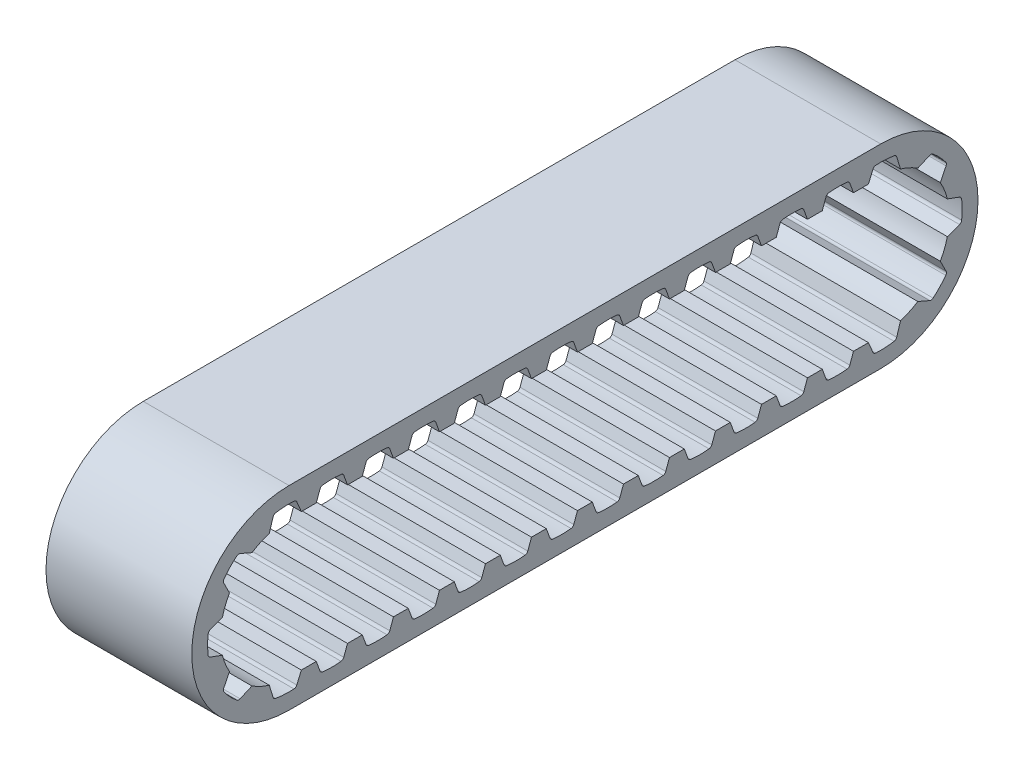
from build123d import *

# Parameters (mm, degrees)
SKETCH_2_W            = 5.8
SKETCH_2_H            = 1.14
CUT_EXTRUDE_1_DEPTH   = 28.834467159
PATTERN_START         = -2.9
PATTERN_CURVE_1_DEPTH = 5.8


# Read off the part's stored shape, not the designer's step: 曲线阵列1
with BuildPart() as part:
    # 扫描1: sweep along a path in 草图1
    with BuildLine(Plane(origin=(0, 0, 0), x_dir=(0, 0, -1), z_dir=(1, 0, 0))) as sweep_1_path:
        Line((0, 3.871), (23.54, 3.871))
        ThreePointArc((23.54, 3.871), (27.411, 0), (23.54, -3.871))
        Line((23.54, -3.871), (0, -3.871))
        ThreePointArc((0, -3.871), (-3.871, 0), (0, 3.871))
    # 草图2 → 扫描1 (sweep)
    with BuildSketch(Plane.XY):
        with Locations((0, 3.301)):
            Rectangle(SKETCH_2_W, SKETCH_2_H)
    sweep(path=sweep_1_path.line)

    # 草图3 → 切除-拉伸1 (cut, symmetric)
    with BuildSketch(Plane(origin=(0, 0, 0), x_dir=(0, 0, -1), z_dir=(1, 0, 0))):
        with BuildLine():
            Line((-3.135600662, 0.473139521), (-1.457, 1.084100197))
            Line((-1.457, 1.084100197), (-1.457, -1.084100197))
            Line((-1.457, -1.084100197), (-3.135600662, -0.473139521))
            ThreePointArc((-3.135600662, -0.473139521), (-3.193244809, -0.431441946), (-3.220308068, -0.365645932))
            ThreePointArc((-3.220308068, -0.365645932), (-3.241, 0), (-3.220308068, 0.365645932))
            ThreePointArc((-3.220308068, 0.365645932), (-3.193244809, 0.431441946), (-3.135600662, 0.473139521))
        make_face()
    extrude(amount=CUT_EXTRUDE_1_DEPTH, both=True, mode=Mode.SUBTRACT)

    # 曲线阵列1 outline → 曲线阵列1 (cut)
    with BuildSketch(Plane.YZ.offset(PATTERN_START)):
        with BuildLine():
            ThreePointArc((2.501432533, 1.949022269), (2.510859431, 2.019539423), (2.481755951, 2.084458779))
            ThreePointArc((2.481755951, 2.084458779), (2.23074509, 2.351139584), (1.951250165, 2.587799025))
            ThreePointArc((1.951250165, 2.587799025), (1.88489199, 2.613453032), (1.814967209, 2.600335853))
            Line((1.814967209, 2.600335853), (1.355181001, 2.371043115))
            ThreePointArc((1.355181001, 2.371043115), (1.879717631, 1.981166986), (2.296602394, 1.477828963))
            Line((2.296602394, 1.477828963), (2.501432533, 1.949022269))
        make_face()
        with BuildLine():
            Line((-2.501432533, 1.949022269), (-2.296602394, 1.477828963))
            ThreePointArc((-2.296602394, 1.477828963), (-1.879717631, 1.981166986), (-1.355181001, 2.371043115))
            Line((-1.355181001, 2.371043115), (-1.814967209, 2.600335853))
            ThreePointArc((-1.814967209, 2.600335853), (-1.88489199, 2.613453032), (-1.951250165, 2.587799025))
            ThreePointArc((-1.951250165, 2.587799025), (-2.23074509, 2.351139584), (-2.481755951, 2.084458779))
            ThreePointArc((-2.481755951, 2.084458779), (-2.510859431, 2.019539423), (-2.501432533, 1.949022269))
        make_face()
        with BuildLine():
            Line((-3.156121228, -0.307817011), (-2.731, -0.488360795))
            Line((-2.731, -0.488360795), (-2.731, 0))
            ThreePointArc((-2.731, 0), (-2.701859768, 0.397887919), (-2.615060933, 0.787284776))
            Line((-2.615060933, 0.787284776), (-3.106426315, 0.637156238))
            ThreePointArc((-3.106426315, 0.637156238), (-3.166180712, 0.59854345), (-3.196661978, 0.534259487))
            ThreePointArc((-3.196661978, 0.534259487), (-3.236527666, 0.170204779), (-3.235066597, -0.19602325))
            ThreePointArc((-3.235066597, -0.19602325), (-3.211496035, -0.263149728), (-3.156121228, -0.307817011))
        make_face()
        with BuildLine():
            Line((-3.135600662, -2.176722499), (-2.731, -2.323985096))
            Line((-2.731, -2.323985096), (-2.731, -1.083180859))
            Line((-2.731, -1.083180859), (-3.135600662, -1.230443456))
            ThreePointArc((-3.135600662, -1.230443456), (-3.193244809, -1.272141031), (-3.220308068, -1.337937045))
            ThreePointArc((-3.220308068, -1.337937045), (-3.241, -1.703582978), (-3.220308068, -2.06922891))
            ThreePointArc((-3.220308068, -2.06922891), (-3.193244809, -2.135024924), (-3.135600662, -2.176722499))
        make_face()
        with BuildLine():
            Line((-3.135600662, -4.006980139), (-2.731, -4.154242737))
            Line((-2.731, -4.154242737), (-2.731, -2.913438499))
            Line((-2.731, -2.913438499), (-3.135600662, -3.060701097))
            ThreePointArc((-3.135600662, -3.060701097), (-3.193244809, -3.102398672), (-3.220308068, -3.168194685))
            ThreePointArc((-3.220308068, -3.168194685), (-3.241, -3.533840618), (-3.220308068, -3.89948655))
            ThreePointArc((-3.220308068, -3.89948655), (-3.193244809, -3.965282564), (-3.135600662, -4.006980139))
        make_face()
        with BuildLine():
            Line((-3.135600662, -5.837237779), (-2.731, -5.984500377))
            Line((-2.731, -5.984500377), (-2.731, -4.743696139))
            Line((-2.731, -4.743696139), (-3.135600662, -4.890958737))
            ThreePointArc((-3.135600662, -4.890958737), (-3.193244809, -4.932656312), (-3.220308068, -4.998452326))
            ThreePointArc((-3.220308068, -4.998452326), (-3.241, -5.364098259), (-3.220308068, -5.729744191))
            ThreePointArc((-3.220308068, -5.729744191), (-3.193244809, -5.795540205), (-3.135600662, -5.837237779))
        make_face()
        with BuildLine():
            Line((-3.135600662, -7.66749542), (-2.731, -7.814758018))
            Line((-2.731, -7.814758018), (-2.731, -6.57395378))
            Line((-2.731, -6.57395378), (-3.135600662, -6.721216378))
            ThreePointArc((-3.135600662, -6.721216378), (-3.193244809, -6.762913953), (-3.220308068, -6.828709966))
            ThreePointArc((-3.220308068, -6.828709966), (-3.241, -7.194355898), (-3.220308068, -7.560001831))
            ThreePointArc((-3.220308068, -7.560001831), (-3.193244809, -7.625797845), (-3.135600662, -7.66749542))
        make_face()
        with BuildLine():
            Line((-3.135600662, -9.49775306), (-2.731, -9.645015658))
            Line((-2.731, -9.645015658), (-2.731, -8.40421142))
            Line((-2.731, -8.40421142), (-3.135600662, -8.551474018))
            ThreePointArc((-3.135600662, -8.551474018), (-3.193244809, -8.593171593), (-3.220308068, -8.658967607))
            ThreePointArc((-3.220308068, -8.658967607), (-3.241, -9.02461354), (-3.220308068, -9.390259472))
            ThreePointArc((-3.220308068, -9.390259472), (-3.193244809, -9.456055486), (-3.135600662, -9.49775306))
        make_face()
        with BuildLine():
            Line((-3.135600662, -11.328010701), (-2.731, -11.475273299))
            Line((-2.731, -11.475273299), (-2.731, -10.234469061))
            Line((-2.731, -10.234469061), (-3.135600662, -10.381731659))
            ThreePointArc((-3.135600662, -10.381731659), (-3.193244809, -10.423429233), (-3.220308068, -10.489225247))
            ThreePointArc((-3.220308068, -10.489225247), (-3.241, -10.854871179), (-3.220308068, -11.220517112))
            ThreePointArc((-3.220308068, -11.220517112), (-3.193244809, -11.286313126), (-3.135600662, -11.328010701))
        make_face()
        with BuildLine():
            Line((-3.135600662, -13.158268341), (-2.731, -13.305530939))
            Line((-2.731, -13.305530939), (-2.731, -12.064726701))
            Line((-2.731, -12.064726701), (-3.135600662, -12.211989299))
            ThreePointArc((-3.135600662, -12.211989299), (-3.193244809, -12.253686874), (-3.220308068, -12.319482888))
            ThreePointArc((-3.220308068, -12.319482888), (-3.241, -12.685128821), (-3.220308068, -13.050774753))
            ThreePointArc((-3.220308068, -13.050774753), (-3.193244809, -13.116570767), (-3.135600662, -13.158268341))
        make_face()
        with BuildLine():
            Line((-3.135600662, -14.988525982), (-2.731, -15.13578858))
            Line((-2.731, -15.13578858), (-2.731, -13.894984342))
            Line((-2.731, -13.894984342), (-3.135600662, -14.04224694))
            ThreePointArc((-3.135600662, -14.04224694), (-3.193244809, -14.083944514), (-3.220308068, -14.149740528))
            ThreePointArc((-3.220308068, -14.149740528), (-3.241, -14.515386461), (-3.220308068, -14.881032393))
            ThreePointArc((-3.220308068, -14.881032393), (-3.193244809, -14.946828407), (-3.135600662, -14.988525982))
        make_face()
        with BuildLine():
            Line((-3.135600662, -16.818783622), (-2.731, -16.96604622))
            Line((-2.731, -16.96604622), (-2.731, -15.725241982))
            Line((-2.731, -15.725241982), (-3.135600662, -15.87250458))
            ThreePointArc((-3.135600662, -15.87250458), (-3.193244809, -15.914202155), (-3.220308068, -15.979998169))
            ThreePointArc((-3.220308068, -15.979998169), (-3.241, -16.345644101), (-3.220308068, -16.711290034))
            ThreePointArc((-3.220308068, -16.711290034), (-3.193244809, -16.777086047), (-3.135600662, -16.818783622))
        make_face()
        with BuildLine():
            Line((-3.135600662, -18.649041263), (-2.731, -18.796303861))
            Line((-2.731, -18.796303861), (-2.731, -17.555499623))
            Line((-2.731, -17.555499623), (-3.135600662, -17.702762221))
            ThreePointArc((-3.135600662, -17.702762221), (-3.193244809, -17.744459795), (-3.220308068, -17.810255809))
            ThreePointArc((-3.220308068, -17.810255809), (-3.241, -18.175901741), (-3.220308068, -18.541547674))
            ThreePointArc((-3.220308068, -18.541547674), (-3.193244809, -18.607343688), (-3.135600662, -18.649041263))
        make_face()
        with BuildLine():
            Line((-3.135600662, -20.479298903), (-2.731, -20.626561501))
            Line((-2.731, -20.626561501), (-2.731, -19.385757263))
            Line((-2.731, -19.385757263), (-3.135600662, -19.533019861))
            ThreePointArc((-3.135600662, -19.533019861), (-3.193244809, -19.574717436), (-3.220308068, -19.64051345))
            ThreePointArc((-3.220308068, -19.64051345), (-3.241, -20.006159382), (-3.220308068, -20.371805315))
            ThreePointArc((-3.220308068, -20.371805315), (-3.193244809, -20.437601328), (-3.135600662, -20.479298903))
        make_face()
        with BuildLine():
            Line((-3.135600662, -22.309556544), (-2.731, -22.456819141))
            Line((-2.731, -22.456819141), (-2.731, -21.216014904))
            Line((-2.731, -21.216014904), (-3.135600662, -21.363277501))
            ThreePointArc((-3.135600662, -21.363277501), (-3.193244809, -21.404975076), (-3.220308068, -21.47077109))
            ThreePointArc((-3.220308068, -21.47077109), (-3.241, -21.836417023), (-3.220308068, -22.202062955))
            ThreePointArc((-3.220308068, -22.202062955), (-3.193244809, -22.267858969), (-3.135600662, -22.309556544))
        make_face()
        with BuildLine():
            Line((-3.106426315, -24.177156238), (-2.615060933, -24.327284776))
            ThreePointArc((-2.615060933, -24.327284776), (-2.701859768, -23.937887919), (-2.731, -23.54))
            Line((-2.731, -23.54), (-2.731, -23.051639205))
            Line((-2.731, -23.051639205), (-3.156121228, -23.232182989))
            ThreePointArc((-3.156121228, -23.232182989), (-3.211496035, -23.276850272), (-3.235066597, -23.34397675))
            ThreePointArc((-3.235066597, -23.34397675), (-3.236527666, -23.710204779), (-3.196661978, -24.074259487))
            ThreePointArc((-3.196661978, -24.074259487), (-3.166180712, -24.13854345), (-3.106426315, -24.177156238))
        make_face()
        with BuildLine():
            Line((-1.814967209, -26.140335853), (-1.355181001, -25.911043115))
            ThreePointArc((-1.355181001, -25.911043115), (-1.879717631, -25.521166986), (-2.296602394, -25.017828963))
            Line((-2.296602394, -25.017828963), (-2.501432533, -25.489022269))
            ThreePointArc((-2.501432533, -25.489022269), (-2.510859431, -25.559539423), (-2.481755951, -25.624458779))
            ThreePointArc((-2.481755951, -25.624458779), (-2.23074509, -25.891139584), (-1.951250165, -26.127799025))
            ThreePointArc((-1.951250165, -26.127799025), (-1.88489199, -26.153453032), (-1.814967209, -26.140335853))
        make_face()
        with BuildLine():
            Line((0.473139521, -26.675600662), (0.648865502, -26.192797497))
            ThreePointArc((0.648865502, -26.192797497), (0, -26.271), (-0.648865502, -26.192797497))
            Line((-0.648865502, -26.192797497), (-0.473139521, -26.675600662))
            ThreePointArc((-0.473139521, -26.675600662), (-0.431441946, -26.733244809), (-0.365645932, -26.760308068))
            ThreePointArc((-0.365645932, -26.760308068), (0, -26.781), (0.365645932, -26.760308068))
            ThreePointArc((0.365645932, -26.760308068), (0.431441946, -26.733244809), (0.473139521, -26.675600662))
        make_face()
        with BuildLine():
            Line((2.501432533, -25.489022269), (2.296602394, -25.017828963))
            ThreePointArc((2.296602394, -25.017828963), (1.879717631, -25.521166986), (1.355181001, -25.911043115))
            Line((1.355181001, -25.911043115), (1.814967209, -26.140335853))
            ThreePointArc((1.814967209, -26.140335853), (1.88489199, -26.153453032), (1.951250165, -26.127799025))
            ThreePointArc((1.951250165, -26.127799025), (2.23074509, -25.891139584), (2.481755951, -25.624458779))
            ThreePointArc((2.481755951, -25.624458779), (2.510859431, -25.559539423), (2.501432533, -25.489022269))
        make_face()
        with BuildLine():
            Line((3.156121228, -23.232182989), (2.731, -23.051639205))
            Line((2.731, -23.051639205), (2.731, -23.54))
            ThreePointArc((2.731, -23.54), (2.701859768, -23.937887919), (2.615060933, -24.327284776))
            Line((2.615060933, -24.327284776), (3.106426315, -24.177156238))
            ThreePointArc((3.106426315, -24.177156238), (3.166180712, -24.13854345), (3.196661978, -24.074259487))
            ThreePointArc((3.196661978, -24.074259487), (3.236527666, -23.710204779), (3.235066597, -23.34397675))
            ThreePointArc((3.235066597, -23.34397675), (3.211496035, -23.276850272), (3.156121228, -23.232182989))
        make_face()
        with BuildLine():
            Line((3.135600662, -21.363277501), (2.731, -21.216014904))
            Line((2.731, -21.216014904), (2.731, -22.456819141))
            Line((2.731, -22.456819141), (3.135600662, -22.309556544))
            ThreePointArc((3.135600662, -22.309556544), (3.193244809, -22.267858969), (3.220308068, -22.202062955))
            ThreePointArc((3.220308068, -22.202062955), (3.241, -21.836417023), (3.220308068, -21.47077109))
            ThreePointArc((3.220308068, -21.47077109), (3.193244809, -21.404975076), (3.135600662, -21.363277501))
        make_face()
        with BuildLine():
            Line((3.135600662, -19.533019861), (2.731, -19.385757263))
            Line((2.731, -19.385757263), (2.731, -20.626561501))
            Line((2.731, -20.626561501), (3.135600662, -20.479298903))
            ThreePointArc((3.135600662, -20.479298903), (3.193244809, -20.437601328), (3.220308068, -20.371805315))
            ThreePointArc((3.220308068, -20.371805315), (3.241, -20.006159383), (3.220308068, -19.64051345))
            ThreePointArc((3.220308068, -19.64051345), (3.193244809, -19.574717436), (3.135600662, -19.533019861))
        make_face()
        with BuildLine():
            Line((3.135600662, -17.702762221), (2.731, -17.555499623))
            Line((2.731, -17.555499623), (2.731, -18.796303861))
            Line((2.731, -18.796303861), (3.135600662, -18.649041263))
            ThreePointArc((3.135600662, -18.649041263), (3.193244809, -18.607343688), (3.220308068, -18.541547674))
            ThreePointArc((3.220308068, -18.541547674), (3.241, -18.175901742), (3.220308068, -17.810255809))
            ThreePointArc((3.220308068, -17.810255809), (3.193244809, -17.744459795), (3.135600662, -17.702762221))
        make_face()
        with BuildLine():
            Line((3.135600662, -15.87250458), (2.731, -15.725241982))
            Line((2.731, -15.725241982), (2.731, -16.96604622))
            Line((2.731, -16.96604622), (3.135600662, -16.818783622))
            ThreePointArc((3.135600662, -16.818783622), (3.193244809, -16.777086047), (3.220308068, -16.711290034))
            ThreePointArc((3.220308068, -16.711290034), (3.241, -16.345644101), (3.220308068, -15.979998169))
            ThreePointArc((3.220308068, -15.979998169), (3.193244809, -15.914202155), (3.135600662, -15.87250458))
        make_face()
        with BuildLine():
            Line((3.135600662, -14.04224694), (2.731, -13.894984342))
            Line((2.731, -13.894984342), (2.731, -15.13578858))
            Line((2.731, -15.13578858), (3.135600662, -14.988525982))
            ThreePointArc((3.135600662, -14.988525982), (3.193244809, -14.946828407), (3.220308068, -14.881032393))
            ThreePointArc((3.220308068, -14.881032393), (3.241, -14.515386461), (3.220308068, -14.149740528))
            ThreePointArc((3.220308068, -14.149740528), (3.193244809, -14.083944514), (3.135600662, -14.04224694))
        make_face()
        with BuildLine():
            Line((3.135600662, -12.211989299), (2.731, -12.064726701))
            Line((2.731, -12.064726701), (2.731, -13.305530939))
            Line((2.731, -13.305530939), (3.135600662, -13.158268341))
            ThreePointArc((3.135600662, -13.158268341), (3.193244809, -13.116570767), (3.220308068, -13.050774753))
            ThreePointArc((3.220308068, -13.050774753), (3.241, -12.685128821), (3.220308068, -12.319482888))
            ThreePointArc((3.220308068, -12.319482888), (3.193244809, -12.253686874), (3.135600662, -12.211989299))
        make_face()
        with BuildLine():
            Line((3.135600662, -10.381731659), (2.731, -10.234469061))
            Line((2.731, -10.234469061), (2.731, -11.475273299))
            Line((2.731, -11.475273299), (3.135600662, -11.328010701))
            ThreePointArc((3.135600662, -11.328010701), (3.193244809, -11.286313126), (3.220308068, -11.220517112))
            ThreePointArc((3.220308068, -11.220517112), (3.241, -10.854871179), (3.220308068, -10.489225247))
            ThreePointArc((3.220308068, -10.489225247), (3.193244809, -10.423429233), (3.135600662, -10.381731659))
        make_face()
        with BuildLine():
            Line((3.135600662, -8.551474018), (2.731, -8.40421142))
            Line((2.731, -8.40421142), (2.731, -9.645015658))
            Line((2.731, -9.645015658), (3.135600662, -9.49775306))
            ThreePointArc((3.135600662, -9.49775306), (3.193244809, -9.456055486), (3.220308068, -9.390259472))
            ThreePointArc((3.220308068, -9.390259472), (3.241, -9.02461354), (3.220308068, -8.658967607))
            ThreePointArc((3.220308068, -8.658967607), (3.193244809, -8.593171593), (3.135600662, -8.551474018))
        make_face()
        with BuildLine():
            Line((3.135600662, -6.721216378), (2.731, -6.57395378))
            Line((2.731, -6.57395378), (2.731, -7.814758018))
            Line((2.731, -7.814758018), (3.135600662, -7.66749542))
            ThreePointArc((3.135600662, -7.66749542), (3.193244809, -7.625797845), (3.220308068, -7.560001831))
            ThreePointArc((3.220308068, -7.560001831), (3.241, -7.194355898), (3.220308068, -6.828709966))
            ThreePointArc((3.220308068, -6.828709966), (3.193244809, -6.762913953), (3.135600662, -6.721216378))
        make_face()
        with BuildLine():
            Line((3.135600662, -4.890958737), (2.731, -4.743696139))
            Line((2.731, -4.743696139), (2.731, -5.984500377))
            Line((2.731, -5.984500377), (3.135600662, -5.837237779))
            ThreePointArc((3.135600662, -5.837237779), (3.193244809, -5.795540205), (3.220308068, -5.729744191))
            ThreePointArc((3.220308068, -5.729744191), (3.241, -5.364098259), (3.220308068, -4.998452326))
            ThreePointArc((3.220308068, -4.998452326), (3.193244809, -4.932656312), (3.135600662, -4.890958737))
        make_face()
        with BuildLine():
            Line((3.135600662, -3.060701097), (2.731, -2.913438499))
            Line((2.731, -2.913438499), (2.731, -4.154242737))
            Line((2.731, -4.154242737), (3.135600662, -4.006980139))
            ThreePointArc((3.135600662, -4.006980139), (3.193244809, -3.965282564), (3.220308068, -3.89948655))
            ThreePointArc((3.220308068, -3.89948655), (3.241, -3.533840618), (3.220308068, -3.168194685))
            ThreePointArc((3.220308068, -3.168194685), (3.193244809, -3.102398672), (3.135600662, -3.060701097))
        make_face()
        with BuildLine():
            Line((3.135600662, -1.230443456), (2.731, -1.083180859))
            Line((2.731, -1.083180859), (2.731, -2.323985096))
            Line((2.731, -2.323985096), (3.135600662, -2.176722499))
            ThreePointArc((3.135600662, -2.176722499), (3.193244809, -2.135024924), (3.220308068, -2.06922891))
            ThreePointArc((3.220308068, -2.06922891), (3.241, -1.703582977), (3.220308068, -1.337937045))
            ThreePointArc((3.220308068, -1.337937045), (3.193244809, -1.272141031), (3.135600662, -1.230443456))
        make_face()
        with BuildLine():
            Line((3.106426315, 0.637156238), (2.615060933, 0.787284776))
            ThreePointArc((2.615060933, 0.787284776), (2.701859768, 0.397887919), (2.731, 0))
            Line((2.731, 0), (2.731, -0.488360795))
            Line((2.731, -0.488360795), (3.156121228, -0.307817011))
            ThreePointArc((3.156121228, -0.307817011), (3.211496035, -0.263149728), (3.235066597, -0.19602325))
            ThreePointArc((3.235066597, -0.19602325), (3.236527666, 0.170204779), (3.196661978, 0.534259487))
            ThreePointArc((3.196661978, 0.534259487), (3.166180712, 0.59854345), (3.106426315, 0.637156238))
        make_face()
    extrude(amount=PATTERN_CURVE_1_DEPTH, mode=Mode.SUBTRACT)


solid = part.part
